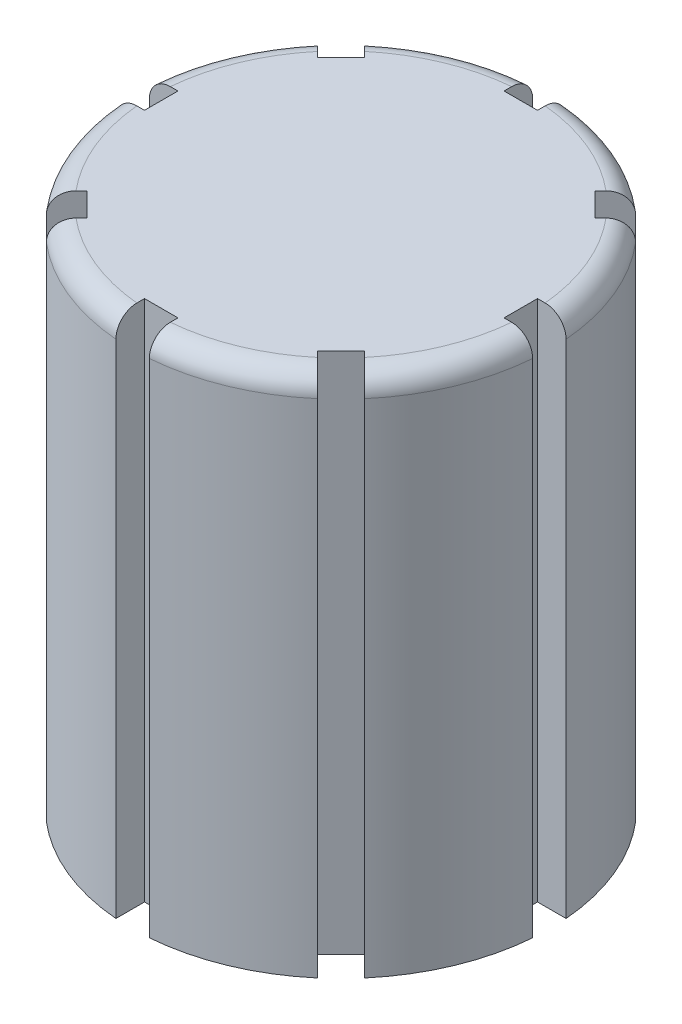
from build123d import *

# Parameters (mm, degrees)
SKETCH1_R              = 10
BOSS_EXTRUDE1_DEPTH    = 25
SKETCH2_R              = 6.625
CUT_EXTRUDE1_DEPTH     = 20
CHAMFER1_SIZE          = 1
CUT_SWEEP1_PITCH       = 2
CUT_SWEEP1_HEIGHT      = 19.5
CUT_SWEEP1_RADIUS      = 6.625
CUT_SWEEP1_START_ANGLE = -90
FILLET1_R              = 1
CUT_EXTRUDE2_REACH     = 30.723
SKETCH6_W              = 1.6
SKETCH6_H              = 2
SKETCH6_W_2            = 2
SKETCH6_H_2            = 1.6


with BuildPart() as part:
    # Sketch1 → Boss-Extrude1 (new body)
    with BuildSketch(Plane(origin=(0, 0, 0), x_dir=(1, 0, 0), z_dir=(0, 1, 0))):
        with Locations(Location((0, 0, 0), (0, 0, 270))):
            Circle(SKETCH1_R)
    extrude(amount=BOSS_EXTRUDE1_DEPTH)

    # Sketch2 → Cut-Extrude1 (cut)
    with BuildSketch(Plane.XZ):
        with Locations(Location((0, 0, 0), (0, 0, 270))):
            Circle(SKETCH2_R)
    extrude(amount=-CUT_EXTRUDE1_DEPTH, mode=Mode.SUBTRACT)

    # Chamfer1
    chamfer1_edges = [part.edges().sort_by_distance(p)[0] for p in [
        (0, 0, 6.625),
    ]]
    chamfer(chamfer1_edges, length=CHAMFER1_SIZE)

    # Cut-Sweep1: sweep along a helix
    with BuildLine() as cut_sweep1_path:
        add(Helix(CUT_SWEEP1_PITCH, CUT_SWEEP1_HEIGHT, CUT_SWEEP1_RADIUS, center=(0, 0, 0), direction=(0, 1, 0), mode=Mode.PRIVATE).rotate(Axis((0, 0, 0), (0, 1, 0)), CUT_SWEEP1_START_ANGLE))
    # Sketch5 → Cut-Sweep1 (sweep, cut)
    with BuildSketch(Plane(origin=(0, 0, 0), x_dir=(0, 0, -1), z_dir=(1, 0, 0))):
        Polygon((7.5, 19.5), (6.5, 18.65), (6.5, 20.174289748), align=None)
    sweep(path=cut_sweep1_path.line, is_frenet=True, mode=Mode.SUBTRACT)

    # Fillet1
    fillet1_edges = [part.edges().sort_by_distance(p)[0] for p in [
        (0, 25, -10),
    ]]
    fillet(fillet1_edges, radius=FILLET1_R)

    # Sketch6 → Cut-Extrude2 (cut, up to next)
    with BuildSketch(Plane.XZ, mode=Mode.PRIVATE) as cut_extrude2_sk1:
        Polygon((5.515432893, 6.646803743), (6.929646456, 8.061017306), (8.061017306, 6.929646456), (6.646803743, 5.515432893), align=None)
    cut_extrude2_tool1 = extrude(cut_extrude2_sk1.sketch, amount=-CUT_EXTRUDE2_REACH, mode=Mode.PRIVATE) & part.part
    # Sketch6 → Cut-Extrude2 (cut, up to next)
    with BuildSketch(Plane.XZ, mode=Mode.PRIVATE) as cut_extrude2_sk2:
        with Locations((0, 9.6)):
            Rectangle(SKETCH6_W, SKETCH6_H)
    cut_extrude2_tool2 = extrude(cut_extrude2_sk2.sketch, amount=-CUT_EXTRUDE2_REACH, mode=Mode.PRIVATE) & part.part
    # Sketch6 → Cut-Extrude2 (cut, up to next)
    with BuildSketch(Plane.XZ, mode=Mode.PRIVATE) as cut_extrude2_sk3:
        with Locations((9.6, 0)):
            Rectangle(SKETCH6_W_2, SKETCH6_H_2)
    cut_extrude2_tool3 = extrude(cut_extrude2_sk3.sketch, amount=-CUT_EXTRUDE2_REACH, mode=Mode.PRIVATE) & part.part
    # Sketch6 → Cut-Extrude2 (cut, up to next)
    with BuildSketch(Plane.XZ, mode=Mode.PRIVATE) as cut_extrude2_sk4:
        Polygon((6.646803743, -5.515432893), (8.061017306, -6.929646456), (6.929646456, -8.061017306), (5.515432893, -6.646803743), align=None)
    cut_extrude2_tool4 = extrude(cut_extrude2_sk4.sketch, amount=-CUT_EXTRUDE2_REACH, mode=Mode.PRIVATE) & part.part
    # Sketch6 → Cut-Extrude2 (cut, up to next)
    with BuildSketch(Plane.XZ, mode=Mode.PRIVATE) as cut_extrude2_sk5:
        with Locations((0, -9.6)):
            Rectangle(SKETCH6_W, SKETCH6_H)
    cut_extrude2_tool5 = extrude(cut_extrude2_sk5.sketch, amount=-CUT_EXTRUDE2_REACH, mode=Mode.PRIVATE) & part.part
    # Sketch6 → Cut-Extrude2 (cut, up to next)
    with BuildSketch(Plane.XZ, mode=Mode.PRIVATE) as cut_extrude2_sk6:
        Polygon((-5.515432893, -6.646803743), (-6.929646456, -8.061017306), (-8.061017306, -6.929646456), (-6.646803743, -5.515432893), align=None)
    cut_extrude2_tool6 = extrude(cut_extrude2_sk6.sketch, amount=-CUT_EXTRUDE2_REACH, mode=Mode.PRIVATE) & part.part
    # Sketch6 → Cut-Extrude2 (cut, up to next)
    with BuildSketch(Plane.XZ, mode=Mode.PRIVATE) as cut_extrude2_sk7:
        with Locations((-9.6, 0)):
            Rectangle(SKETCH6_W_2, SKETCH6_H_2)
    cut_extrude2_tool7 = extrude(cut_extrude2_sk7.sketch, amount=-CUT_EXTRUDE2_REACH, mode=Mode.PRIVATE) & part.part
    # Sketch6 → Cut-Extrude2 (cut, up to next)
    with BuildSketch(Plane.XZ, mode=Mode.PRIVATE) as cut_extrude2_sk8:
        Polygon((-6.646803743, 5.515432893), (-8.061017306, 6.929646456), (-6.929646456, 8.061017306), (-5.515432893, 6.646803743), align=None)
    cut_extrude2_tool8 = extrude(cut_extrude2_sk8.sketch, amount=-CUT_EXTRUDE2_REACH, mode=Mode.PRIVATE) & part.part
    add(cut_extrude2_tool1.solids().sort_by_distance((6.788225, 0, 6.788225))[0], mode=Mode.SUBTRACT)
    add(cut_extrude2_tool2.solids().sort_by_distance((0, 0, 9.6))[0], mode=Mode.SUBTRACT)
    add(cut_extrude2_tool3.solids().sort_by_distance((9.6, 0, 0))[0], mode=Mode.SUBTRACT)
    add(cut_extrude2_tool4.solids().sort_by_distance((6.788225, 0, -6.788225))[0], mode=Mode.SUBTRACT)
    add(cut_extrude2_tool5.solids().sort_by_distance((0, 0, -9.6))[0], mode=Mode.SUBTRACT)
    add(cut_extrude2_tool6.solids().sort_by_distance((-6.788225, 0, -6.788225))[0], mode=Mode.SUBTRACT)
    add(cut_extrude2_tool7.solids().sort_by_distance((-9.6, 0, 0))[0], mode=Mode.SUBTRACT)
    add(cut_extrude2_tool8.solids().sort_by_distance((-6.788225, 0, 6.788225))[0], mode=Mode.SUBTRACT)


solid = part.part
